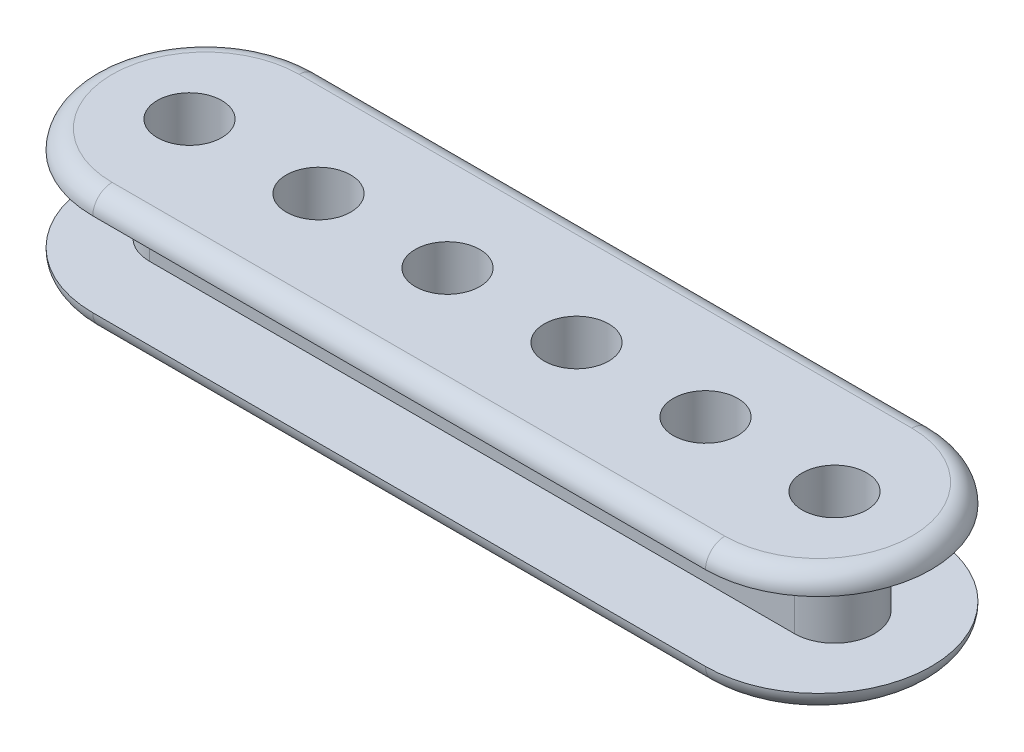
from build123d import *
from build123d.topology import SkipClean

# Parameters (mm, degrees)
BOSS_EXTRUDE1_DEPTH     = 1.524
SKETCH2_R               = 1.27
BOSS_EXTRUDE2_DEPTH     = 6.604
BOSS_EXTRUDE3_DEPTH     = 1.524
FILLET1_R               = 1.524
CUT_EXTRUDE1_DEPTH      = 36.148497607
CUT_EXTRUDE1_DEPTH_BACK = 36.148497607
SKETCH2_3_R             = 1.27
CUT_EXTRUDE2_DEPTH      = 36.531867443
CUT_EXTRUDE2_DEPTH_BACK = 36.531867443
SKETCH4_R               = 2.54


with BuildPart() as part:
    # Sketch1 → Boss-Extrude1 (new body)
    with BuildSketch(Plane(origin=(0, 0, 0), x_dir=(1, 0, 0), z_dir=(0, 1, 0))):
        with BuildLine():
            Line((24.13, -8.89), (-24.13, -8.89))
            ThreePointArc((-24.13, -8.89), (-33.02, 0), (-24.13, 8.89))
            Line((-24.13, 8.89), (24.13, 8.89))
            ThreePointArc((24.13, 8.89), (33.02, 0), (24.13, -8.89))
        make_face()
    extrude(amount=BOSS_EXTRUDE1_DEPTH)

    # Sketch2 → Boss-Extrude2 (add)
    # profile 1 of 35: a face of its own
    with BuildSketch(Plane(origin=(0, 1.524, 0), x_dir=(1, 0, 0), z_dir=(0, 1, 0))):
        with BuildLine():
            ThreePointArc((-22.643661095, 1.524), (-23.8000016, 2.71292928), (-25.4, 3.1496))
            ThreePointArc((-25.4, 3.1496), (-28.5496, 0), (-25.4, -3.1496))
            ThreePointArc((-25.4, -3.1496), (-23.8000016, -2.71292928), (-22.643661095, -1.524))
            Line((-22.643661095, -1.524), (-25.4, -1.524))
            Line((-25.4, -1.524), (-25.4, -1.27))
            ThreePointArc((-25.4, -1.27), (-26.67, 0), (-25.4, 1.27))
            Line((-25.4, 1.27), (-25.4, 1.524))
            Line((-25.4, 1.524), (-22.643661095, 1.524))
        make_face()
    # profile 2 of 35: a face of its own
    with BuildSketch(Plane(origin=(0, 1.524, 0), x_dir=(1, 0, 0), z_dir=(0, 1, 0))):
        with BuildLine():
            ThreePointArc((-22.2504, 0), (-22.35029959, 0.786960972), (-22.643661095, 1.524))
            Line((-22.643661095, 1.524), (-25.4, 1.524))
            Line((-25.4, 1.524), (-25.4, 1.27))
            ThreePointArc((-25.4, 1.27), (-24.501974388, 0.898025612), (-24.13, 0))
            ThreePointArc((-24.13, 0), (-24.501974388, -0.898025612), (-25.4, -1.27))
            Line((-25.4, -1.27), (-25.4, -1.524))
            Line((-25.4, -1.524), (-22.643661095, -1.524))
            ThreePointArc((-22.643661095, -1.524), (-22.35029959, -0.786960972), (-22.2504, 0))
        make_face()
    # profile 3 of 35: a face of its own
    with BuildSketch(Plane(origin=(0, 1.524, 0), x_dir=(1, 0, 0), z_dir=(0, 1, 0))):
        with BuildLine():
            Line((-15.24, 3.1496), (-25.4, 3.1496))
            ThreePointArc((-25.4, 3.1496), (-23.8000016, 2.71292928), (-22.643661095, 1.524))
            Line((-22.643661095, 1.524), (-17.996338905, 1.524))
            ThreePointArc((-17.996338905, 1.524), (-16.8399984, 2.71292928), (-15.24, 3.1496))
        make_face()
    # profile 4 of 35: a face of its own
    with BuildSketch(Plane(origin=(0, 1.524, 0), x_dir=(1, 0, 0), z_dir=(0, 1, 0))):
        with BuildLine():
            Line((-17.996338905, 1.524), (-22.643661095, 1.524))
            ThreePointArc((-22.643661095, 1.524), (-22.35029959, 0.786960972), (-22.2504, 0))
            ThreePointArc((-22.2504, 0), (-22.35029959, -0.786960972), (-22.643661095, -1.524))
            Line((-22.643661095, -1.524), (-17.996338905, -1.524))
            ThreePointArc((-17.996338905, -1.524), (-18.3896, 0), (-17.996338905, 1.524))
        make_face()
    # profile 5 of 35: a face of its own
    with BuildSketch(Plane(origin=(0, 1.524, 0), x_dir=(1, 0, 0), z_dir=(0, 1, 0))):
        with BuildLine():
            ThreePointArc((-22.643661095, 1.524), (-23.8000016, 2.71292928), (-25.4, 3.1496))
            ThreePointArc((-25.4, 3.1496), (-28.5496, 0), (-25.4, -3.1496))
            ThreePointArc((-25.4, -3.1496), (-23.8000016, -2.71292928), (-22.643661095, -1.524))
            Line((-22.643661095, -1.524), (-25.4, -1.524))
            Line((-25.4, -1.524), (-25.4, -1.27))
            ThreePointArc((-25.4, -1.27), (-26.67, 0), (-25.4, 1.27))
            Line((-25.4, 1.27), (-25.4, 1.524))
            Line((-25.4, 1.524), (-22.643661095, 1.524))
        make_face()
    # profile 6 of 35: a face of its own
    with BuildSketch(Plane(origin=(0, 1.524, 0), x_dir=(1, 0, 0), z_dir=(0, 1, 0))):
        with BuildLine():
            ThreePointArc((-22.2504, 0), (-22.35029959, 0.786960972), (-22.643661095, 1.524))
            Line((-22.643661095, 1.524), (-25.4, 1.524))
            Line((-25.4, 1.524), (-25.4, 1.27))
            ThreePointArc((-25.4, 1.27), (-24.501974388, 0.898025612), (-24.13, 0))
            ThreePointArc((-24.13, 0), (-24.501974388, -0.898025612), (-25.4, -1.27))
            Line((-25.4, -1.27), (-25.4, -1.524))
            Line((-25.4, -1.524), (-22.643661095, -1.524))
            ThreePointArc((-22.643661095, -1.524), (-22.35029959, -0.786960972), (-22.2504, 0))
        make_face()
    # profile 7 of 35: a face of its own
    with BuildSketch(Plane(origin=(0, 1.524, 0), x_dir=(1, 0, 0), z_dir=(0, 1, 0))):
        with BuildLine():
            ThreePointArc((-22.643661095, -1.524), (-23.8000016, -2.71292928), (-25.4, -3.1496))
            Line((-25.4, -3.1496), (-15.24, -3.1496))
            ThreePointArc((-15.24, -3.1496), (-16.8399984, -2.71292928), (-17.996338905, -1.524))
            Line((-17.996338905, -1.524), (-22.643661095, -1.524))
        make_face()
    # profile 8 of 35: a face of its own
    with BuildSketch(Plane(origin=(0, 1.524, 0), x_dir=(1, 0, 0), z_dir=(0, 1, 0))):
        with BuildLine():
            ThreePointArc((-17.996338905, -1.524), (-16.8399984, -2.71292928), (-15.24, -3.1496))
            ThreePointArc((-15.24, -3.1496), (-13.6400016, -2.71292928), (-12.483661095, -1.524))
            Line((-12.483661095, -1.524), (-17.996338905, -1.524))
        make_face()
    # profile 9 of 35: a face of its own
    with BuildSketch(Plane(origin=(0, 1.524, 0), x_dir=(1, 0, 0), z_dir=(0, 1, 0))):
        with BuildLine():
            ThreePointArc((-12.0904, 0), (-12.19029959, 0.786960972), (-12.483661095, 1.524))
            Line((-12.483661095, 1.524), (-17.996338905, 1.524))
            ThreePointArc((-17.996338905, 1.524), (-18.3896, 0), (-17.996338905, -1.524))
            Line((-17.996338905, -1.524), (-12.483661095, -1.524))
            ThreePointArc((-12.483661095, -1.524), (-12.19029959, -0.786960972), (-12.0904, 0))
        make_face()
        with Locations(Location((-15.24, 0, 0), (0, 0, 90))):
            Circle(SKETCH2_R, mode=Mode.SUBTRACT)
    # profile 10 of 35: a face of its own
    with BuildSketch(Plane(origin=(0, 1.524, 0), x_dir=(1, 0, 0), z_dir=(0, 1, 0))):
        with BuildLine():
            ThreePointArc((-12.483661095, 1.524), (-13.6400016, 2.71292928), (-15.24, 3.1496))
            ThreePointArc((-15.24, 3.1496), (-16.8399984, 2.71292928), (-17.996338905, 1.524))
            Line((-17.996338905, 1.524), (-12.483661095, 1.524))
        make_face()
    # profile 11 of 35: a face of its own
    with BuildSketch(Plane(origin=(0, 1.524, 0), x_dir=(1, 0, 0), z_dir=(0, 1, 0))):
        with BuildLine():
            Line((-5.080000024, 3.1496), (-15.24, 3.1496))
            ThreePointArc((-15.24, 3.1496), (-13.6400016, 2.71292928), (-12.483661095, 1.524))
            Line((-12.483661095, 1.524), (-7.836338905, 1.524))
            ThreePointArc((-7.836338905, 1.524), (-6.67999841, 2.712929274), (-5.080000024, 3.1496))
        make_face()
    # profile 12 of 35: a face of its own
    with BuildSketch(Plane(origin=(0, 1.524, 0), x_dir=(1, 0, 0), z_dir=(0, 1, 0))):
        with BuildLine():
            Line((-7.836338905, 1.524), (-12.483661095, 1.524))
            ThreePointArc((-12.483661095, 1.524), (-12.19029959, 0.786960972), (-12.0904, 0))
            ThreePointArc((-12.0904, 0), (-12.19029959, -0.786960972), (-12.483661095, -1.524))
            Line((-12.483661095, -1.524), (-7.836338905, -1.524))
            ThreePointArc((-7.836338905, -1.524), (-8.2296, 0), (-7.836338905, 1.524))
        make_face()
    # profile 13 of 35: a face of its own
    with BuildSketch(Plane(origin=(0, 1.524, 0), x_dir=(1, 0, 0), z_dir=(0, 1, 0))):
        with BuildLine():
            ThreePointArc((-12.483661095, -1.524), (-13.6400016, -2.71292928), (-15.24, -3.1496))
            Line((-15.24, -3.1496), (-5.080000009, -3.1496))
            ThreePointArc((-5.080000009, -3.1496), (-6.679998404, -2.712929278), (-7.836338905, -1.524))
            Line((-7.836338905, -1.524), (-12.483661095, -1.524))
        make_face()
    # profile 14 of 35: a face of its own
    with BuildSketch(Plane(origin=(0, 1.524, 0), x_dir=(1, 0, 0), z_dir=(0, 1, 0))):
        with BuildLine():
            ThreePointArc((-7.836338905, -1.524), (-6.679998404, -2.712929278), (-5.080000009, -3.1496))
            ThreePointArc((-5.080000009, -3.1496), (-3.480001604, -2.712929283), (-2.323661095, -1.524))
            Line((-2.323661095, -1.524), (-7.836338905, -1.524))
        make_face()
    # profile 15 of 35: a face of its own
    with BuildSketch(Plane(origin=(0, 1.524, 0), x_dir=(1, 0, 0), z_dir=(0, 1, 0))):
        with BuildLine():
            ThreePointArc((-1.9304, 0), (-2.03029959, 0.786960972), (-2.323661095, 1.524))
            Line((-2.323661095, 1.524), (-7.836338905, 1.524))
            ThreePointArc((-7.836338905, 1.524), (-8.2296, 0), (-7.836338905, -1.524))
            Line((-7.836338905, -1.524), (-2.323661095, -1.524))
            ThreePointArc((-2.323661095, -1.524), (-2.03029959, -0.786960972), (-1.9304, 0))
        make_face()
        with Locations(Location((-5.08, 0, 0), (0, 0, 90))):
            Circle(SKETCH2_R, mode=Mode.SUBTRACT)
    # profile 16 of 35: a face of its own
    with BuildSketch(Plane(origin=(0, 1.524, 0), x_dir=(1, 0, 0), z_dir=(0, 1, 0))):
        with BuildLine():
            ThreePointArc((-2.323661095, 1.524), (-3.48000161, 2.712929286), (-5.080000024, 3.1496))
            ThreePointArc((-5.080000024, 3.1496), (-6.67999841, 2.712929274), (-7.836338905, 1.524))
            Line((-7.836338905, 1.524), (-2.323661095, 1.524))
        make_face()
    # profile 17 of 35: a face of its own
    with BuildSketch(Plane(origin=(0, 1.524, 0), x_dir=(1, 0, 0), z_dir=(0, 1, 0))):
        with BuildLine():
            Line((5.079999991, 3.1496), (-5.080000024, 3.1496))
            ThreePointArc((-5.080000024, 3.1496), (-3.48000161, 2.712929286), (-2.323661095, 1.524))
            Line((-2.323661095, 1.524), (2.323661095, 1.524))
            ThreePointArc((2.323661095, 1.524), (3.480001596, 2.712929278), (5.079999991, 3.1496))
        make_face()
    # profile 18 of 35: a face of its own
    with BuildSketch(Plane(origin=(0, 1.524, 0), x_dir=(1, 0, 0), z_dir=(0, 1, 0))):
        with BuildLine():
            Line((2.323661095, 1.524), (-2.323661095, 1.524))
            ThreePointArc((-2.323661095, 1.524), (-2.03029959, 0.786960972), (-1.9304, 0))
            ThreePointArc((-1.9304, 0), (-2.03029959, -0.786960972), (-2.323661095, -1.524))
            Line((-2.323661095, -1.524), (2.323661095, -1.524))
            ThreePointArc((2.323661095, -1.524), (1.9304, 0), (2.323661095, 1.524))
        make_face()
    # profile 19 of 35: a face of its own
    with BuildSketch(Plane(origin=(0, 1.524, 0), x_dir=(1, 0, 0), z_dir=(0, 1, 0))):
        with BuildLine():
            ThreePointArc((-2.323661095, -1.524), (-3.480001604, -2.712929283), (-5.080000009, -3.1496))
            Line((-5.080000009, -3.1496), (5.079999981, -3.1496))
            ThreePointArc((5.079999981, -3.1496), (3.480001592, -2.712929275), (2.323661095, -1.524))
            Line((2.323661095, -1.524), (-2.323661095, -1.524))
        make_face()
    # profile 20 of 35: a face of its own
    with BuildSketch(Plane(origin=(0, 1.524, 0), x_dir=(1, 0, 0), z_dir=(0, 1, 0))):
        with BuildLine():
            ThreePointArc((2.323661095, -1.524), (3.480001592, -2.712929275), (5.079999981, -3.1496))
            ThreePointArc((5.079999981, -3.1496), (6.679998392, -2.712929285), (7.836338905, -1.524))
            Line((7.836338905, -1.524), (2.323661095, -1.524))
        make_face()
    # profile 21 of 35: a face of its own
    with BuildSketch(Plane(origin=(0, 1.524, 0), x_dir=(1, 0, 0), z_dir=(0, 1, 0))):
        with BuildLine():
            ThreePointArc((8.2296, 0), (8.12970041, 0.786960972), (7.836338905, 1.524))
            Line((7.836338905, 1.524), (2.323661095, 1.524))
            ThreePointArc((2.323661095, 1.524), (1.9304, 0), (2.323661095, -1.524))
            Line((2.323661095, -1.524), (7.836338905, -1.524))
            ThreePointArc((7.836338905, -1.524), (8.12970041, -0.786960972), (8.2296, 0))
        make_face()
        with Locations(Location((5.08, 0, 0), (0, 0, 90))):
            Circle(SKETCH2_R, mode=Mode.SUBTRACT)
    # profile 22 of 35: a face of its own
    with BuildSketch(Plane(origin=(0, 1.524, 0), x_dir=(1, 0, 0), z_dir=(0, 1, 0))):
        with BuildLine():
            ThreePointArc((7.836338905, 1.524), (6.679998396, 2.712929283), (5.079999991, 3.1496))
            ThreePointArc((5.079999991, 3.1496), (3.480001596, 2.712929278), (2.323661095, 1.524))
            Line((2.323661095, 1.524), (7.836338905, 1.524))
        make_face()
    # profile 23 of 35: a face of its own
    with BuildSketch(Plane(origin=(0, 1.524, 0), x_dir=(1, 0, 0), z_dir=(0, 1, 0))):
        with BuildLine():
            Line((15.240000007, 3.1496), (5.079999991, 3.1496))
            ThreePointArc((5.079999991, 3.1496), (6.679998396, 2.712929283), (7.836338905, 1.524))
            Line((7.836338905, 1.524), (12.483661095, 1.524))
            ThreePointArc((12.483661095, 1.524), (13.640001603, 2.712929282), (15.240000007, 3.1496))
        make_face()
    # profile 24 of 35: a face of its own
    with BuildSketch(Plane(origin=(0, 1.524, 0), x_dir=(1, 0, 0), z_dir=(0, 1, 0))):
        with BuildLine():
            Line((12.483661095, 1.524), (7.836338905, 1.524))
            ThreePointArc((7.836338905, 1.524), (8.12970041, 0.786960972), (8.2296, 0))
            ThreePointArc((8.2296, 0), (8.12970041, -0.786960972), (7.836338905, -1.524))
            Line((7.836338905, -1.524), (12.483661095, -1.524))
            ThreePointArc((12.483661095, -1.524), (12.0904, 0), (12.483661095, 1.524))
        make_face()
    # profile 25 of 35: a face of its own
    with BuildSketch(Plane(origin=(0, 1.524, 0), x_dir=(1, 0, 0), z_dir=(0, 1, 0))):
        with BuildLine():
            ThreePointArc((7.836338905, -1.524), (6.679998392, -2.712929285), (5.079999981, -3.1496))
            Line((5.079999981, -3.1496), (15.24, -3.1496))
            ThreePointArc((15.24, -3.1496), (13.6400016, -2.71292928), (12.483661095, -1.524))
            Line((12.483661095, -1.524), (7.836338905, -1.524))
        make_face()
    # profile 26 of 35: a face of its own
    with BuildSketch(Plane(origin=(0, 1.524, 0), x_dir=(1, 0, 0), z_dir=(0, 1, 0))):
        with BuildLine():
            ThreePointArc((12.483661095, -1.524), (13.6400016, -2.71292928), (15.24, -3.1496))
            ThreePointArc((15.24, -3.1496), (16.8399984, -2.71292928), (17.996338905, -1.524))
            Line((17.996338905, -1.524), (12.483661095, -1.524))
        make_face()
    # profile 27 of 35: a face of its own
    with BuildSketch(Plane(origin=(0, 1.524, 0), x_dir=(1, 0, 0), z_dir=(0, 1, 0))):
        with BuildLine():
            ThreePointArc((18.3896, 0), (18.28970041, 0.786960972), (17.996338905, 1.524))
            Line((17.996338905, 1.524), (12.483661095, 1.524))
            ThreePointArc((12.483661095, 1.524), (12.0904, 0), (12.483661095, -1.524))
            Line((12.483661095, -1.524), (17.996338905, -1.524))
            ThreePointArc((17.996338905, -1.524), (18.28970041, -0.786960972), (18.3896, 0))
        make_face()
        with Locations(Location((15.24, 0, 0), (0, 0, 90))):
            Circle(SKETCH2_R, mode=Mode.SUBTRACT)
    # profile 28 of 35: a face of its own
    with BuildSketch(Plane(origin=(0, 1.524, 0), x_dir=(1, 0, 0), z_dir=(0, 1, 0))):
        with BuildLine():
            ThreePointArc((17.996338905, 1.524), (16.839998403, 2.712929279), (15.240000007, 3.1496))
            ThreePointArc((15.240000007, 3.1496), (13.640001603, 2.712929282), (12.483661095, 1.524))
            Line((12.483661095, 1.524), (17.996338905, 1.524))
        make_face()
    # profile 29 of 35: a face of its own
    with BuildSketch(Plane(origin=(0, 1.524, 0), x_dir=(1, 0, 0), z_dir=(0, 1, 0))):
        with BuildLine():
            Line((25.4, 3.1496), (15.240000007, 3.1496))
            ThreePointArc((15.240000007, 3.1496), (16.839998403, 2.712929279), (17.996338905, 1.524))
            Line((17.996338905, 1.524), (22.643661095, 1.524))
            ThreePointArc((22.643661095, 1.524), (23.8000016, 2.71292928), (25.4, 3.1496))
        make_face()
    # profile 30 of 35: a face of its own
    with BuildSketch(Plane(origin=(0, 1.524, 0), x_dir=(1, 0, 0), z_dir=(0, 1, 0))):
        with BuildLine():
            ThreePointArc((17.996338905, -1.524), (16.8399984, -2.71292928), (15.24, -3.1496))
            Line((15.24, -3.1496), (25.4, -3.1496))
            ThreePointArc((25.4, -3.1496), (23.8000016, -2.71292928), (22.643661095, -1.524))
            Line((22.643661095, -1.524), (17.996338905, -1.524))
        make_face()
    # profile 31 of 35: a face of its own
    with BuildSketch(Plane(origin=(0, 1.524, 0), x_dir=(1, 0, 0), z_dir=(0, 1, 0))):
        with BuildLine():
            Line((22.643661095, 1.524), (17.996338905, 1.524))
            ThreePointArc((17.996338905, 1.524), (18.28970041, 0.786960972), (18.3896, 0))
            ThreePointArc((18.3896, 0), (18.28970041, -0.786960972), (17.996338905, -1.524))
            Line((17.996338905, -1.524), (22.643661095, -1.524))
            ThreePointArc((22.643661095, -1.524), (22.2504, 0), (22.643661095, 1.524))
        make_face()
    # profile 32 of 35: a face of its own
    with BuildSketch(Plane(origin=(0, 1.524, 0), x_dir=(1, 0, 0), z_dir=(0, 1, 0))):
        with BuildLine():
            ThreePointArc((28.5496, 0), (27.627103518, 2.227103518), (25.4, 3.1496))
            ThreePointArc((25.4, 3.1496), (23.8000016, 2.71292928), (22.643661095, 1.524))
            Line((22.643661095, 1.524), (25.4, 1.524))
            Line((25.4, 1.524), (25.4, 1.27))
            ThreePointArc((25.4, 1.27), (26.298025612, 0.898025612), (26.67, 0))
            ThreePointArc((26.67, 0), (26.298025612, -0.898025612), (25.4, -1.27))
            Line((25.4, -1.27), (25.4, -1.524))
            Line((25.4, -1.524), (22.643661095, -1.524))
            ThreePointArc((22.643661095, -1.524), (23.8000016, -2.71292928), (25.4, -3.1496))
            ThreePointArc((25.4, -3.1496), (27.627103518, -2.227103518), (28.5496, 0))
        make_face()
    # profile 33 of 35: a face of its own
    with BuildSketch(Plane(origin=(0, 1.524, 0), x_dir=(1, 0, 0), z_dir=(0, 1, 0))):
        with BuildLine():
            Line((25.4, 1.524), (22.643661095, 1.524))
            ThreePointArc((22.643661095, 1.524), (22.2504, 0), (22.643661095, -1.524))
            Line((22.643661095, -1.524), (25.4, -1.524))
            Line((25.4, -1.524), (25.4, -1.27))
            ThreePointArc((25.4, -1.27), (24.13, 0), (25.4, 1.27))
            Line((25.4, 1.27), (25.4, 1.524))
        make_face()
    # profile 34 of 35: a face of its own
    with BuildSketch(Plane(origin=(0, 1.524, 0), x_dir=(1, 0, 0), z_dir=(0, 1, 0))):
        with BuildLine():
            ThreePointArc((28.5496, 0), (27.627103518, 2.227103518), (25.4, 3.1496))
            ThreePointArc((25.4, 3.1496), (23.8000016, 2.71292928), (22.643661095, 1.524))
            Line((22.643661095, 1.524), (25.4, 1.524))
            Line((25.4, 1.524), (25.4, 1.27))
            ThreePointArc((25.4, 1.27), (26.298025612, 0.898025612), (26.67, 0))
            ThreePointArc((26.67, 0), (26.298025612, -0.898025612), (25.4, -1.27))
            Line((25.4, -1.27), (25.4, -1.524))
            Line((25.4, -1.524), (22.643661095, -1.524))
            ThreePointArc((22.643661095, -1.524), (23.8000016, -2.71292928), (25.4, -3.1496))
            ThreePointArc((25.4, -3.1496), (27.627103518, -2.227103518), (28.5496, 0))
        make_face()
    # profile 35 of 35: a face of its own
    with BuildSketch(Plane(origin=(0, 1.524, 0), x_dir=(1, 0, 0), z_dir=(0, 1, 0))):
        with BuildLine():
            Line((25.4, 1.524), (22.643661095, 1.524))
            ThreePointArc((22.643661095, 1.524), (22.2504, 0), (22.643661095, -1.524))
            Line((22.643661095, -1.524), (25.4, -1.524))
            Line((25.4, -1.524), (25.4, -1.27))
            ThreePointArc((25.4, -1.27), (24.13, 0), (25.4, 1.27))
            Line((25.4, 1.27), (25.4, 1.524))
        make_face()
    extrude(amount=BOSS_EXTRUDE2_DEPTH)

    # Sketch3 → Boss-Extrude3 (add)
    with BuildSketch(Plane(origin=(0, 8.128, 0), x_dir=(1, 0, 0), z_dir=(0, 1, 0))):
        with BuildLine():
            Line((-24.13, -8.89), (24.13, -8.89))
            ThreePointArc((24.13, -8.89), (33.02, 0), (24.13, 8.89))
            Line((24.13, 8.89), (-24.13, 8.89))
            ThreePointArc((-24.13, 8.89), (-33.02, 0), (-24.13, -8.89))
        make_face()
    extrude(amount=BOSS_EXTRUDE3_DEPTH)

    # Fillet1
    fillet1_edges = [part.edges().sort_by_distance(p)[0] for p in [
        (33.02, 0, 0),
        (0, 0, -8.89),
        (0, 0, 8.89),
        (-33.02, 0, 0),
        (33.02, 9.652, 0),
        (0, 9.652, 8.89),
        (0, 9.652, -8.89),
        (-33.02, 9.652, 0),
    ]]
    fillet(fillet1_edges, radius=FILLET1_R - 0.0001)  # a hair under: the kernel refuses the full size

    # Sketch2<3> → Cut-Extrude1 (cut, two sides: drawn at the far end of the back side and taken through both)
    with SkipClean():  # the faces are left unmerged after this step: merging them gives an invalid solid
        with BuildSketch(Plane(origin=(0, 1.524, 0), x_dir=(1, 0, 0), z_dir=(0, 1, 0)).offset(-CUT_EXTRUDE1_DEPTH_BACK)):
            with Locations(Location((-25.4, 0, 0), (0, 0, 90))):
                Circle(SKETCH2_3_R)
            with Locations(Location((-15.24, 0, 0), (0, 0, 90))):
                Circle(SKETCH2_3_R)
            with Locations(Location((-5.08, 0, 0), (0, 0, 90))):
                Circle(SKETCH2_3_R)
            with Locations(Location((5.08, 0, 0), (0, 0, 90))):
                Circle(SKETCH2_3_R)
            with Locations(Location((15.24, 0, 0), (0, 0, 90))):
                Circle(SKETCH2_3_R)
            with Locations(Location((25.4, 0, 0), (0, 0, 90))):
                Circle(SKETCH2_3_R)
        extrude(amount=CUT_EXTRUDE1_DEPTH + CUT_EXTRUDE1_DEPTH_BACK, mode=Mode.SUBTRACT)

    # Sketch4 → Cut-Extrude2 (cut, two sides: drawn at the far end of the back side and taken through both)
    with BuildSketch(Plane(origin=(0, 9.652, 0), x_dir=(1, 0, 0), z_dir=(0, 1, 0)).offset(-CUT_EXTRUDE2_DEPTH_BACK)):
        with Locations(Location((-25.4, 0, 0), (0, 0, 270))):
            Circle(SKETCH4_R)
        with Locations(Location((-15.24, 0, 0), (0, 0, 270))):
            Circle(SKETCH4_R)
        with Locations(Location((-5.08, 0, 0), (0, 0, 270))):
            Circle(SKETCH4_R)
        with Locations(Location((5.08, 0, 0), (0, 0, 270))):
            Circle(SKETCH4_R)
        with Locations(Location((15.24, 0, 0), (0, 0, 270))):
            Circle(SKETCH4_R)
        with Locations(Location((25.4, 0, 0), (0, 0, 270))):
            Circle(SKETCH4_R)
    extrude(amount=CUT_EXTRUDE2_DEPTH + CUT_EXTRUDE2_DEPTH_BACK, mode=Mode.SUBTRACT)


solid = part.part
